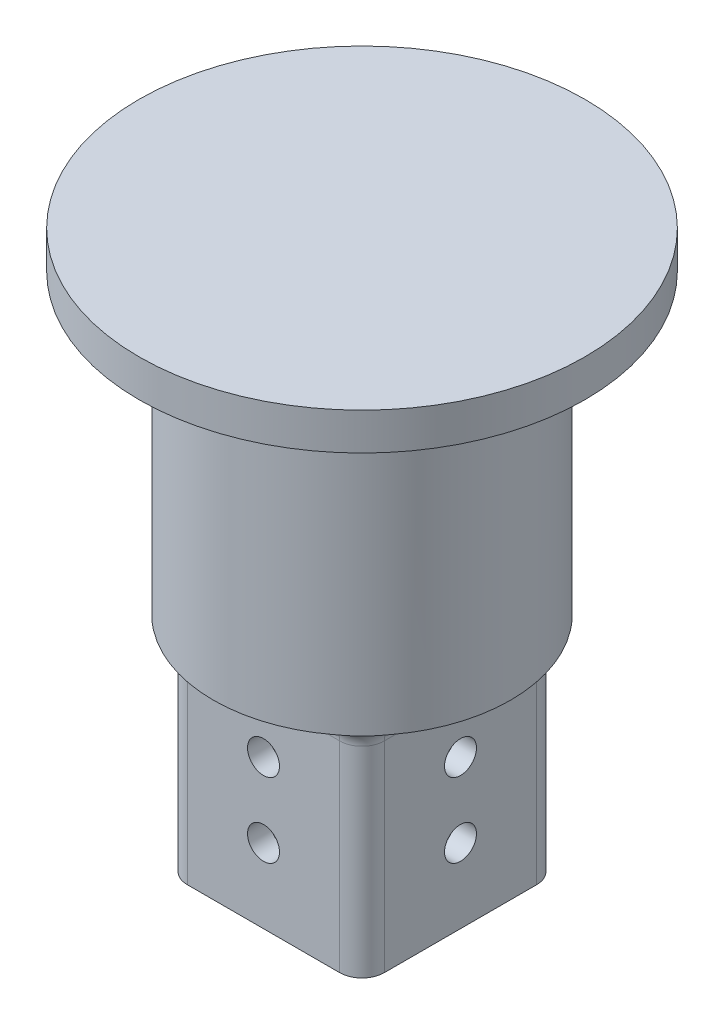
from build123d import *

# Parameters (mm, degrees)
SKETCH_1_R          = 20
SKETCH_1_W          = 20.5
SKETCH_1_H          = 20.5
EXTRUDE_1_DEPTH     = 30
SKETCH_5_R          = 20
EXTRUDE_3_DEPTH     = 10
SKETCH_3_W          = 26.5
SKETCH_3_H          = 26.5
SKETCH_3_W_2        = 20.5
SKETCH_3_H_2        = 20.5
EXTRUDE_4_DEPTH     = 30
SKETCH_6_R          = 2.15
CUT_EXTRUDE_1_DEPTH = 30
SKETCH_7_R          = 2.15
CUT_EXTRUDE_2_DEPTH = 30
FILLET_1_R          = 3
FILLET_2_R          = 3
FILLET_3_R          = 3
FILLET_4_R          = 3
FILLET_5_R          = 3
SKETCH_11_R         = 30
EXTRUDE_5_DEPTH     = 5
FILLET_6_R          = 5


with BuildPart() as part:
    # 草图1 → 凸台-拉伸1 (new body)
    with BuildSketch(Plane(origin=(0, 0, 0), x_dir=(1, 0, 0), z_dir=(0, 1, 0))):
        with Locations(Location((0, 0, 0), (0, 0, 270))):
            Circle(SKETCH_1_R)
        Rectangle(SKETCH_1_W, SKETCH_1_H, mode=Mode.SUBTRACT)
    extrude(amount=EXTRUDE_1_DEPTH)

    # 草图5 → 凸台-拉伸3 (add)
    with BuildSketch(Plane(origin=(0, 30, 0), x_dir=(1, 0, 0), z_dir=(0, 1, 0))):
        with Locations(Location((0, 0, 0), (0, 0, 270))):
            Circle(SKETCH_5_R)
    extrude(amount=EXTRUDE_3_DEPTH)

    # 草图3 → 凸台-拉伸4 (add)
    with BuildSketch(Plane.XZ):
        Rectangle(SKETCH_3_W, SKETCH_3_H)
        Rectangle(SKETCH_3_W_2, SKETCH_3_H_2, mode=Mode.SUBTRACT)
    extrude(amount=EXTRUDE_4_DEPTH)

    # 草图6 → 切除-拉伸1 (cut)
    with BuildSketch(Plane.XY.offset(13.25)):
        with Locations((0, -10)):
            Circle(SKETCH_6_R)
        with Locations((0, -20)):
            Circle(SKETCH_6_R)
    extrude(amount=-CUT_EXTRUDE_1_DEPTH, mode=Mode.SUBTRACT)

    # 草图7 → 切除-拉伸2 (cut)
    with BuildSketch(Plane.ZY.offset(13.25)):
        with Locations((0, -10)):
            Circle(SKETCH_7_R)
        with Locations((0, -20)):
            Circle(SKETCH_7_R)
    extrude(amount=-CUT_EXTRUDE_2_DEPTH, mode=Mode.SUBTRACT)

    # 圆角1
    fillet_1_edges = [part.edges().sort_by_distance(p)[0] for p in [
        (-13.25, -15, 13.25),
    ]]
    fillet(fillet_1_edges, radius=FILLET_1_R)

    # 圆角2
    fillet_2_edges = [part.edges().sort_by_distance(p)[0] for p in [
        (13.25, -15, 13.25),
    ]]
    fillet(fillet_2_edges, radius=FILLET_2_R)

    # 圆角3
    fillet_3_edges = [part.edges().sort_by_distance(p)[0] for p in [
        (13.25, -15, -13.25),
    ]]
    fillet(fillet_3_edges, radius=FILLET_3_R)

    # 圆角4
    fillet_4_edges = [part.edges().sort_by_distance(p)[0] for p in [
        (-13.25, -15, -13.25),
    ]]
    fillet(fillet_4_edges, radius=FILLET_4_R)

    # 圆角5
    # the kernel refuses this fillet: 3 mm, written as the material it adds along each edge
    with BuildSketch(Plane(origin=(10.25, 0, 13.25), x_dir=(0, 0, 1), z_dir=(-1, 0, 0)), Plane(origin=(13.25, 0, -10.25), x_dir=(1, 0, 0), z_dir=(0, 0, 1)), Plane(origin=(-10.25, 0, -13.25), x_dir=(0, 0, -1), z_dir=(1, 0, 0)), Plane(origin=(-13.25, 0, 10.25), x_dir=(-1, 0, 0), z_dir=(0, 0, -1))) as fillet_5_piece_1:
        with BuildLine():
            CenterArc((FILLET_5_R, -FILLET_5_R), FILLET_5_R, 90, 90)
            Line((0, -FILLET_5_R), (0, 0))
            Line((0, 0), (FILLET_5_R, 0))
        make_face()
    extrude(amount=20.5)
    with BuildSketch(Plane(origin=(10.25, 0, 10.25), x_dir=(0, 0, 1), z_dir=(-1, 0, 0))) as fillet_5_piece_2_section:
        with BuildLine():
            CenterArc((3 + FILLET_5_R, -FILLET_5_R), FILLET_5_R, 90, 90)
            Line((3, -FILLET_5_R), (3, 0))
            Line((3, 0), (3 + FILLET_5_R, 0))
        make_face()
    fillet_5_piece_2 = revolve(axis=Axis((10.25, 0, 10.25), (0, 1, 0)), revolution_arc=90, mode=Mode.PRIVATE)
    fillet_5_piece_2 = fillet_5_piece_2 & Plane(origin=(0, -0.618331703, 0), x_dir=(0, 0, 1), z_dir=(0, -1, 0)) * Cylinder(20, 24, mode=Mode.PRIVATE)
    add(fillet_5_piece_2)
    with BuildSketch(Plane(origin=(10.25, 0, -10.25), x_dir=(1, 0, 0), z_dir=(0, 0, 1))) as fillet_5_piece_3_section:
        with BuildLine():
            CenterArc((3 + FILLET_5_R, -FILLET_5_R), FILLET_5_R, 90, 90)
            Line((3, -FILLET_5_R), (3, 0))
            Line((3, 0), (3 + FILLET_5_R, 0))
        make_face()
    fillet_5_piece_3 = revolve(axis=Axis((10.25, 0, -10.25), (0, 1, 0)), revolution_arc=90, mode=Mode.PRIVATE)
    fillet_5_piece_3 = fillet_5_piece_3 & Plane(origin=(0, -0.618331703, 0), x_dir=(0, 0, 1), z_dir=(0, -1, 0)) * Cylinder(20, 24, mode=Mode.PRIVATE)
    add(fillet_5_piece_3)
    with BuildSketch(Plane(origin=(-10.25, 0, -10.25), x_dir=(0, 0, -1), z_dir=(1, 0, 0))) as fillet_5_piece_4_section:
        with BuildLine():
            CenterArc((3 + FILLET_5_R, -FILLET_5_R), FILLET_5_R, 90, 90)
            Line((3, -FILLET_5_R), (3, 0))
            Line((3, 0), (3 + FILLET_5_R, 0))
        make_face()
    fillet_5_piece_4 = revolve(axis=Axis((-10.25, 0, -10.25), (0, 1, 0)), revolution_arc=90, mode=Mode.PRIVATE)
    fillet_5_piece_4 = fillet_5_piece_4 & Plane(origin=(0, -0.618331703, 0), x_dir=(0, 0, 1), z_dir=(0, -1, 0)) * Cylinder(20, 24, mode=Mode.PRIVATE)
    add(fillet_5_piece_4)
    with BuildSketch(Plane(origin=(-10.25, 0, 10.25), x_dir=(-1, 0, 0), z_dir=(0, 0, -1))) as fillet_5_piece_5_section:
        with BuildLine():
            CenterArc((3 + FILLET_5_R, -FILLET_5_R), FILLET_5_R, 90, 90)
            Line((3, -FILLET_5_R), (3, 0))
            Line((3, 0), (3 + FILLET_5_R, 0))
        make_face()
    fillet_5_piece_5 = revolve(axis=Axis((-10.25, 0, 10.25), (0, 1, 0)), revolution_arc=90, mode=Mode.PRIVATE)
    fillet_5_piece_5 = fillet_5_piece_5 & Plane(origin=(0, -0.618331703, 0), x_dir=(0, 0, 1), z_dir=(0, -1, 0)) * Cylinder(20, 24, mode=Mode.PRIVATE)
    add(fillet_5_piece_5)

    # 草图11 → 凸台-拉伸5 (add)
    with BuildSketch(Plane(origin=(0, 40, 0), x_dir=(1, 0, 0), z_dir=(0, 1, 0))):
        with Locations(Location((0, 0, 0), (0, 0, 270))):
            Circle(SKETCH_11_R)
    extrude(amount=EXTRUDE_5_DEPTH)

    # 圆角6
    fillet_6_edges = [part.edges().sort_by_distance(p)[0] for p in [
        (0, 40, -20),
    ]]
    fillet(fillet_6_edges, radius=FILLET_6_R)


solid = part.part
